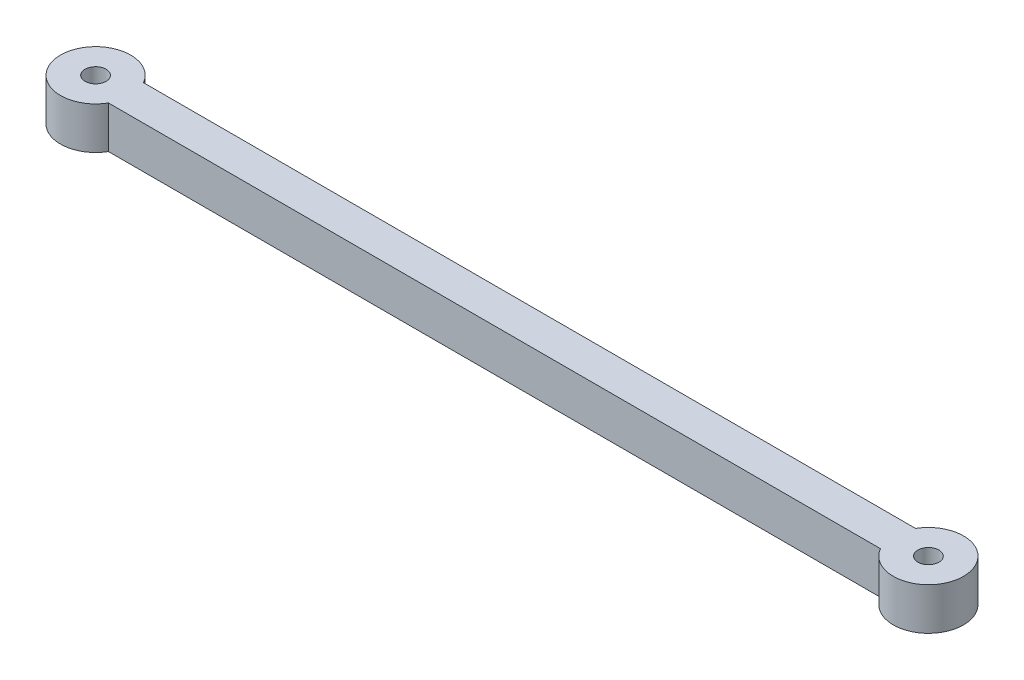
from build123d import *

# Parameters (mm, degrees)
BOSS_EXTRUDE1_DEPTH = 6
SKETCH2_R           = 1.5
CUT_EXTRUDE1_DEPTH  = 65.802509537


with BuildPart() as part:
    # Sketch1 → Boss-Extrude1 (new body)
    with BuildSketch(Plane(origin=(0, 0, 0), x_dir=(1, 0, 0), z_dir=(0, 1, 0))):
        with BuildLine():
            Line((-55, 2.5), (55, 2.5))
            ThreePointArc((55, 2.5), (64.330127019, 0), (55, -2.5))
            Line((55, -2.5), (-55, -2.5))
            ThreePointArc((-55, -2.5), (-64.330127019, 0), (-55, 2.5))
        make_face()
    extrude(amount=BOSS_EXTRUDE1_DEPTH)

    # Sketch2 → Cut-Extrude1 (cut, through all)
    with BuildSketch(Plane(origin=(0, 6, 0), x_dir=(1, 0, 0), z_dir=(0, 1, 0))):
        with Locations((-59.330127019, 0)):
            Circle(SKETCH2_R)
        with Locations((59.330127019, 0)):
            Circle(SKETCH2_R)
    extrude(amount=-CUT_EXTRUDE1_DEPTH, mode=Mode.SUBTRACT)


solid = part.part
